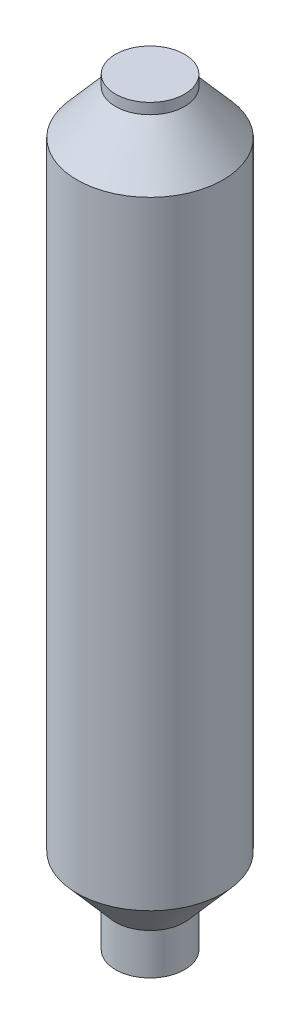
from build123d import *


with BuildPart() as part:
    # Sketch1 → Revolve1 (revolve)
    with BuildSketch(Plane.XY):
        Polygon((0, 0), (0, 70.0000124), (3.188838814, 70.0000124), (3.188838814, 69.0094124), (6.7437, 64.9200124), (6.7437, 7.884011277), (3.188838814, 3.794611277), (3.188838814, 0), align=None)
    revolve(axis=Axis((0, 0, 0), (0, 1, 0)))


solid = part.part
